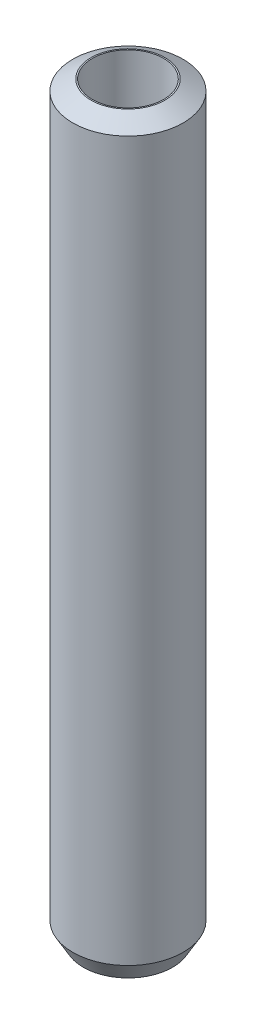
from build123d import *
from OCP.BRepFilletAPI import BRepFilletAPI_MakeChamfer

# Parameters (mm, degrees)
SKETCH1_R           = 22.5
BOSS_EXTRUDE1_DEPTH = 304.493207591
SKETCH2_R           = 14.518205615
CUT_EXTRUDE1_DEPTH  = 307.151291797
CHAMFER1_SIZE       = 4.294327587
CHAMFER1_SIZE2      = 7.437993565


with BuildPart() as part:
    # Sketch1 → Boss-Extrude1 (new body)
    with BuildSketch(Plane(origin=(0, 0, 0), x_dir=(1, 0, 0), z_dir=(0, 1, 0))):
        Circle(SKETCH1_R)
    extrude(amount=BOSS_EXTRUDE1_DEPTH)

    # Sketch2 → Cut-Extrude1 (cut, through all)
    with BuildSketch(Plane(origin=(0, 0, 0), x_dir=(1, 0, 0), z_dir=(0, 1, 0))):
        Circle(SKETCH2_R)
    extrude(amount=CUT_EXTRUDE1_DEPTH, mode=Mode.SUBTRACT)

    # Chamfer1: one chamfer whose edges measure the first distance from different faces: ONE call of the kernel's chamfer builder (chamfer() names one face for all edges)
    chamfer1_edges_1 = [part.edges().sort_by_distance(p)[0] for p in [
        (-22.5, 304.493207591, 0),
    ]]
    chamfer1_side_1 = [part.faces().sort_by_distance(p)[0] for p in [
        (-22.5, 152.246603796, 0),
    ]]
    chamfer1_edges_2 = [part.edges().sort_by_distance(p)[0] for p in [
        (-22.5, 0, 0),
    ]]
    chamfer1_side_2 = [part.faces().sort_by_distance(p)[0] for p in [
        (-21.863603897, 0, 0),
    ]]
    chamfer1 = BRepFilletAPI_MakeChamfer(part.part.solid().wrapped)
    for e in chamfer1_edges_1:
        chamfer1.Add(CHAMFER1_SIZE, CHAMFER1_SIZE2, e.wrapped, chamfer1_side_1[0].wrapped)  # the first distance lies on this face
    for e in chamfer1_edges_2:
        chamfer1.Add(CHAMFER1_SIZE, CHAMFER1_SIZE2, e.wrapped, chamfer1_side_2[0].wrapped)  # the first distance lies on this face
    add(Compound.cast(chamfer1.Shape()), mode=Mode.REPLACE)


solid = part.part
